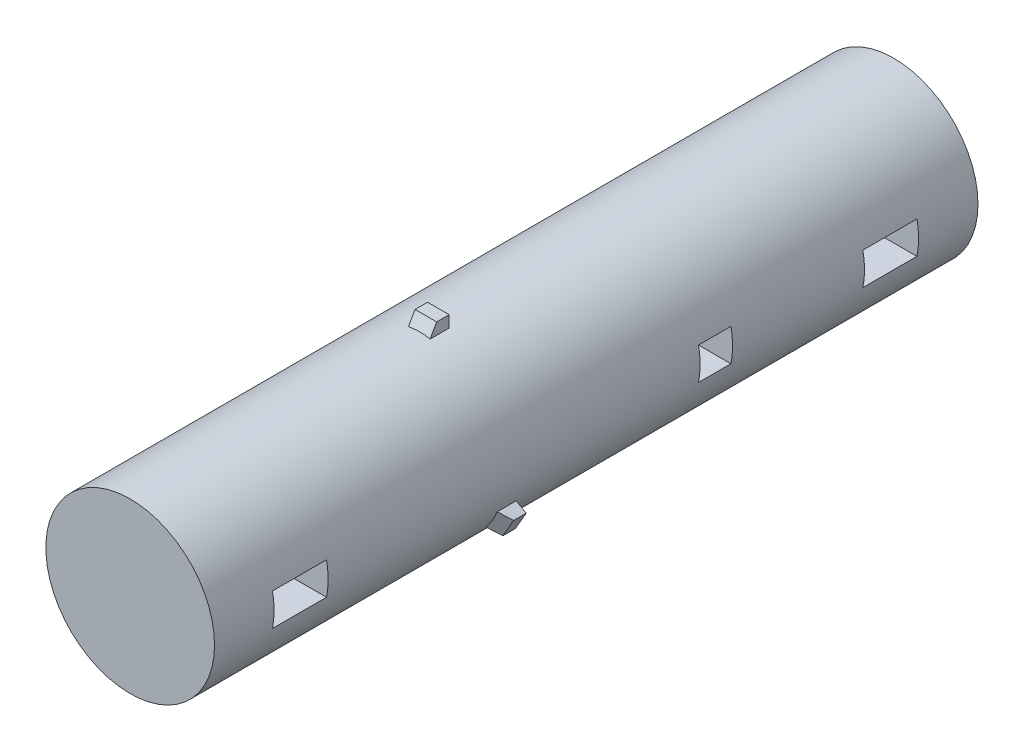
from build123d import *

# Parameters (mm, degrees)
SKETCH1_R               = 3.9
BOSS_EXTRUDE1_DEPTH     = 35.3
SKETCH3_W               = 2.5
SKETCH3_H               = 1.5
CUT_EXTRUDE2_DEPTH      = 36.728280115
CUT_EXTRUDE3_DEPTH      = 36.728280115
CUT_EXTRUDE3_DEPTH_BACK = 36.728280115
SKETCH6_W               = 1.5
SKETCH6_H               = 1.5
BOSS_EXTRUDE2_DEPTH     = 0.5
CIRPATTERN1_COUNT       = 3


with BuildPart() as part:
    # Sketch1 → Boss-Extrude1 (new body)
    with BuildSketch(Plane.XY):
        Circle(SKETCH1_R)
    extrude(amount=BOSS_EXTRUDE1_DEPTH)

    # Sketch3 → Cut-Extrude2 (cut, symmetric)
    with BuildSketch(Plane(origin=(0, 0, 0), x_dir=(0, 0, -1), z_dir=(1, 0, 0))):
        with Locations((-31.3, 0)):
            Rectangle(SKETCH3_W, SKETCH3_H)
    cut_extrude2 = extrude(amount=CUT_EXTRUDE2_DEPTH, both=True, mode=Mode.SUBTRACT)

    # Mirror1: Cut-Extrude2 across plane
    add(cut_extrude2.mirror(Plane.XY.offset(17.65)), mode=Mode.SUBTRACT)

    # Sketch6 → Cut-Extrude3 (cut, two sides: drawn at the far end of the back side and taken through both)
    with BuildSketch(Plane(origin=(0, 0, 0), x_dir=(0, 0, -1), z_dir=(1, 0, 0)).offset(-CUT_EXTRUDE3_DEPTH_BACK)):
        with Locations((-12.1, 0)):
            Rectangle(SKETCH6_W, SKETCH6_H)
    extrude(amount=CUT_EXTRUDE3_DEPTH + CUT_EXTRUDE3_DEPTH_BACK, mode=Mode.SUBTRACT)

    # Sketch7 → Boss-Extrude2 (add, symmetric)
    with BuildSketch(Plane(origin=(0, 0, 0), x_dir=(0, 0, -1), z_dir=(1, 0, 0))):
        Polygon((-21.627350269, 4.4), (-22.204700538, 3.4), (-21.05, 3.4), (-21.05, 4.4), align=None)
    boss_extrude2 = extrude(amount=BOSS_EXTRUDE2_DEPTH, both=True)

    # CirPattern1: Boss-Extrude2 ×3 about axis
    cirpattern1_axis = Axis((0, 0, 0), (0, 0, 1))
    for i in range(1, CIRPATTERN1_COUNT):
        add(boss_extrude2.rotate(cirpattern1_axis, i * 360 / CIRPATTERN1_COUNT))


solid = part.part
